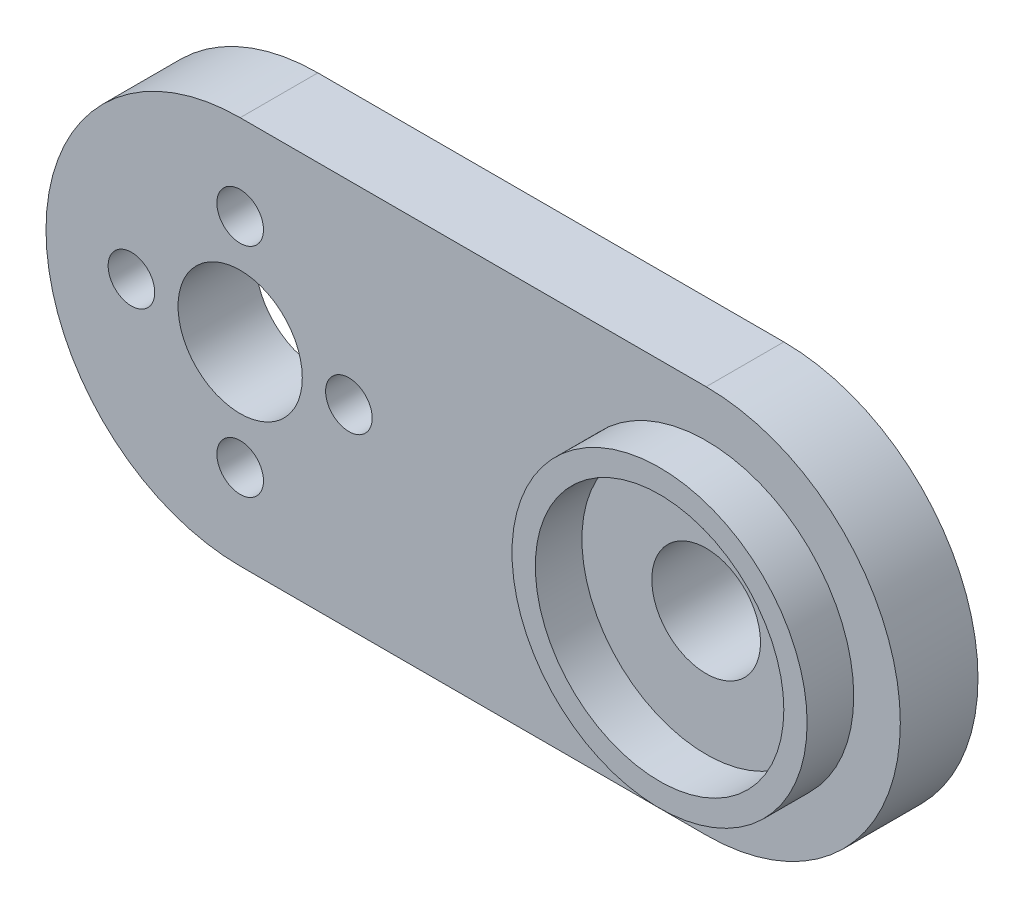
from build123d import *

# Parameters (mm, degrees)
SKETCH1_R           = 12.5
SKETCH1_W           = 30
SKETCH1_H           = 25
BOSS_EXTRUDE2_DEPTH = 5
CUT_EXTRUDE3_REACH  = 51.561
SKETCH3_R           = 4
SKETCH3_R_2         = 3.5
SKETCH3_3_R         = 9.5
SKETCH3_3_R_2       = 8
BOSS_EXTRUDE3_DEPTH = 3
CUT_EXTRUDE4_REACH  = 51.561
SKETCH3_4_R         = 1.5


with BuildPart() as part:
    # Sketch1 → Boss-Extrude2 (new body)
    with BuildSketch(Plane.XY):
        with Locations((0, 12.5)):
            Circle(SKETCH1_R)
        with Locations((30, 12.5)):
            Circle(SKETCH1_R)
        with Locations((15, 12.5)):
            Rectangle(SKETCH1_W, SKETCH1_H)
    extrude(amount=BOSS_EXTRUDE2_DEPTH)

    # Sketch3 → Cut-Extrude3 (cut, up to next)
    with BuildSketch(Plane.XY.offset(5), mode=Mode.PRIVATE) as cut_extrude3_sk1:
        with Locations((0, 12.5)):
            Circle(SKETCH3_R)
    cut_extrude3_tool1 = extrude(cut_extrude3_sk1.sketch, amount=-CUT_EXTRUDE3_REACH, mode=Mode.PRIVATE) & part.part
    # Sketch3 → Cut-Extrude3 (cut, up to next)
    with BuildSketch(Plane.XY.offset(5), mode=Mode.PRIVATE) as cut_extrude3_sk2:
        with Locations((30, 12.5)):
            Circle(SKETCH3_R_2)
    cut_extrude3_tool2 = extrude(cut_extrude3_sk2.sketch, amount=-CUT_EXTRUDE3_REACH, mode=Mode.PRIVATE) & part.part
    add(cut_extrude3_tool1.solids().sort_by_distance((0, 12.5, 5))[0], mode=Mode.SUBTRACT)
    add(cut_extrude3_tool2.solids().sort_by_distance((30, 12.5, 5))[0], mode=Mode.SUBTRACT)

    # Sketch3<3> → Boss-Extrude3 (add)
    with BuildSketch(Plane.XY.offset(5)):
        with Locations((30, 12.5)):
            Circle(SKETCH3_3_R)
        with Locations((30, 12.5)):
            Circle(SKETCH3_3_R_2, mode=Mode.SUBTRACT)
    extrude(amount=BOSS_EXTRUDE3_DEPTH)

    # Sketch3<4> → Cut-Extrude4 (cut, up to next)
    with BuildSketch(Plane.XY.offset(5), mode=Mode.PRIVATE) as cut_extrude4_sk1:
        with Locations((-7, 12.5)):
            Circle(SKETCH3_4_R)
    cut_extrude4_tool1 = extrude(cut_extrude4_sk1.sketch, amount=-CUT_EXTRUDE4_REACH, mode=Mode.PRIVATE) & part.part
    # Sketch3<4> → Cut-Extrude4 (cut, up to next)
    with BuildSketch(Plane.XY.offset(5), mode=Mode.PRIVATE) as cut_extrude4_sk2:
        with Locations((0, 19.5)):
            Circle(SKETCH3_4_R)
    cut_extrude4_tool2 = extrude(cut_extrude4_sk2.sketch, amount=-CUT_EXTRUDE4_REACH, mode=Mode.PRIVATE) & part.part
    # Sketch3<4> → Cut-Extrude4 (cut, up to next)
    with BuildSketch(Plane.XY.offset(5), mode=Mode.PRIVATE) as cut_extrude4_sk3:
        with Locations((7, 12.5)):
            Circle(SKETCH3_4_R)
    cut_extrude4_tool3 = extrude(cut_extrude4_sk3.sketch, amount=-CUT_EXTRUDE4_REACH, mode=Mode.PRIVATE) & part.part
    # Sketch3<4> → Cut-Extrude4 (cut, up to next)
    with BuildSketch(Plane.XY.offset(5), mode=Mode.PRIVATE) as cut_extrude4_sk4:
        with Locations((0, 5.5)):
            Circle(SKETCH3_4_R)
    cut_extrude4_tool4 = extrude(cut_extrude4_sk4.sketch, amount=-CUT_EXTRUDE4_REACH, mode=Mode.PRIVATE) & part.part
    add(cut_extrude4_tool1.solids().sort_by_distance((-7, 12.5, 5))[0], mode=Mode.SUBTRACT)
    add(cut_extrude4_tool2.solids().sort_by_distance((0, 19.5, 5))[0], mode=Mode.SUBTRACT)
    add(cut_extrude4_tool3.solids().sort_by_distance((7, 12.5, 5))[0], mode=Mode.SUBTRACT)
    add(cut_extrude4_tool4.solids().sort_by_distance((0, 5.5, 5))[0], mode=Mode.SUBTRACT)


solid = part.part
